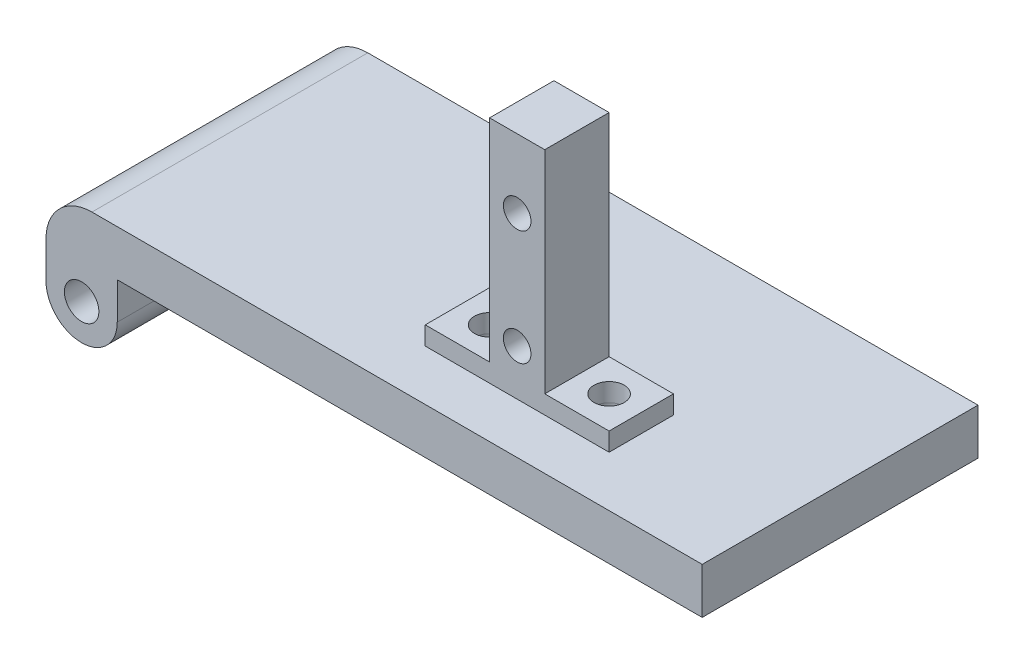
from build123d import *

# Parameters (mm, degrees)
SKETCH1_R               = 2.38125
BOSS_EXTRUDE1_DEPTH     = 38.1
FILLET1_R               = 6.35
SKETCH3_W               = 38.1
SKETCH3_H               = 6.35
BOSS_EXTRUDE2_DEPTH     = 12.7
SKETCH2_W               = 7.62
SKETCH2_H               = 8.89
BOSS_EXTRUDE3_DEPTH     = 31.75
CUT_EXTRUDE1_DEPTH      = 70.699431111
CUT_EXTRUDE1_DEPTH_BACK = 70.699431111
SKETCH5_R               = 1.905
SKETCH6_W               = 25.4
SKETCH6_H               = 8.89
BOSS_EXTRUDE4_DEPTH     = 2.54
CUT_EXTRUDE2_DEPTH      = 71.533296728
CUT_EXTRUDE2_DEPTH_BACK = 71.533296728
SKETCH7_R               = 2.0828


with BuildPart() as part:
    # Sketch1 → Boss-Extrude1 (new body)
    with BuildSketch(Plane.XY):
        with BuildLine():
            Line((-38.973125, -8.255), (-38.973125, -3.175))
            Line((-38.973125, -3.175), (-38.973125, 3.175))
            Line((-38.973125, 3.175), (38.973125, 3.175))
            Line((38.973125, 3.175), (38.973125, -3.175))
            Line((38.973125, -3.175), (-29.130625, -3.175))
            Line((-29.130625, -3.175), (-29.130625, -8.255))
            ThreePointArc((-29.130625, -8.255), (-34.051875, -13.17625), (-38.973125, -8.255))
        make_face()
        with Locations((-34.051875, -8.255)):
            Circle(SKETCH1_R, mode=Mode.SUBTRACT)
    extrude(amount=BOSS_EXTRUDE1_DEPTH)

    # Fillet1
    fillet1_edges = [part.edges().sort_by_distance(p)[0] for p in [
        (-38.973125, 3.175, 19.05),
    ]]
    fillet(fillet1_edges, radius=FILLET1_R)

    # Sketch3 → Boss-Extrude2 (add)
    with BuildSketch(Plane(origin=(38.973125, 0, 0), x_dir=(0, 0, -1), z_dir=(1, 0, 0))):
        with Locations((-19.05, 0)):
            Rectangle(SKETCH3_W, SKETCH3_H)
    extrude(amount=BOSS_EXTRUDE2_DEPTH)

    # Sketch2 → Boss-Extrude3 (add)
    with BuildSketch(Plane(origin=(0, 3.175, 0), x_dir=(1, 0, 0), z_dir=(0, 1, 0))):
        with Locations((19.129375, -26.67)):
            Rectangle(SKETCH2_W, SKETCH2_H)
    extrude(amount=BOSS_EXTRUDE3_DEPTH)

    # Sketch5 → Cut-Extrude1 (cut, two sides: drawn at the far end of the back side and taken through both)
    with BuildSketch(Plane.XY.offset(31.115).offset(-CUT_EXTRUDE1_DEPTH_BACK)):
        with Locations((19.129375, 9.525)):
            Circle(SKETCH5_R)
        with Locations((19.129375, 25.4)):
            Circle(SKETCH5_R)
    extrude(amount=CUT_EXTRUDE1_DEPTH + CUT_EXTRUDE1_DEPTH_BACK, mode=Mode.SUBTRACT)

    # Sketch6 → Boss-Extrude4 (add)
    with BuildSketch(Plane(origin=(0, 3.175, 0), x_dir=(1, 0, 0), z_dir=(0, 1, 0))):
        with Locations((19.129375, -26.67)):
            Rectangle(SKETCH6_W, SKETCH6_H)
    extrude(amount=BOSS_EXTRUDE4_DEPTH)

    # Sketch7 → Cut-Extrude2 (cut, two sides: drawn at the far end of the back side and taken through both)
    with BuildSketch(Plane(origin=(0, 5.715, 0), x_dir=(1, 0, 0), z_dir=(0, 1, 0)).offset(-CUT_EXTRUDE2_DEPTH_BACK)):
        with Locations((10.874375, -26.67)):
            Circle(SKETCH7_R)
        with Locations((27.384375, -26.67)):
            Circle(SKETCH7_R)
    extrude(amount=CUT_EXTRUDE2_DEPTH + CUT_EXTRUDE2_DEPTH_BACK, mode=Mode.SUBTRACT)


with BuildPart() as body_2:
    # Split1: the piece on the far side of the plane
    add(part.part)
    split(bisect_by=Plane(origin=(-38.973125, 3.175, 38.1), x_dir=(0, 0, -1), z_dir=(0, -1, 0)), keep=Keep.BOTTOM)


with BuildPart() as part_1:
    add(part.part)

    # Split1
    split(bisect_by=Plane(origin=(-38.973125, 3.175, 38.1), x_dir=(0, 0, -1), z_dir=(0, -1, 0)), keep=Keep.TOP)


solid = Compound([body_2.part, part_1.part])
